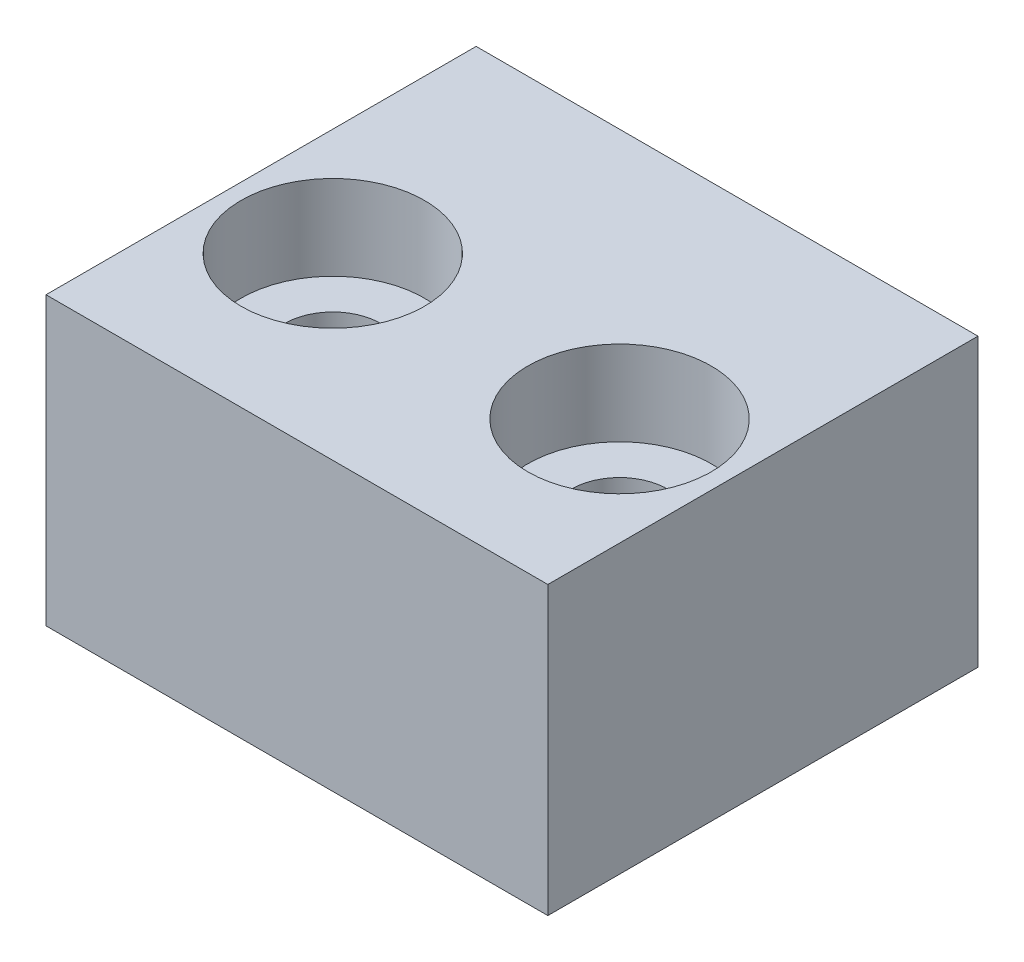
from build123d import *

# Parameters (mm, degrees)
SKETCH1_W                      = 17.78
SKETCH1_H                      = 15.24
BOSS_EXTRUDE1_DEPTH            = 10.16
CBORE_FOR_M3_SHCS1_D           = 3.4
CBORE_FOR_M3_SHCS1_CBORE_D     = 6.5
CBORE_FOR_M3_SHCS1_CBORE_DEPTH = 3


with BuildPart() as part:
    # Sketch1 → Boss-Extrude1 (new body)
    with BuildSketch(Plane(origin=(0, 0, 0), x_dir=(1, 0, 0), z_dir=(0, 1, 0))):
        with Locations((8.89, 7.62)):
            Rectangle(SKETCH1_W, SKETCH1_H)
    extrude(amount=BOSS_EXTRUDE1_DEPTH)

    # CBORE for M3 SHCS1 (through all)
    with Locations(Plane(origin=(0, 10.16, 0), x_dir=(1, 0, 0), z_dir=(0, 1, 0))):
        with Locations((3.81, 6.35), (13.97, 6.35)):
            CounterBoreHole(CBORE_FOR_M3_SHCS1_D / 2, CBORE_FOR_M3_SHCS1_CBORE_D / 2, CBORE_FOR_M3_SHCS1_CBORE_DEPTH)


solid = part.part
